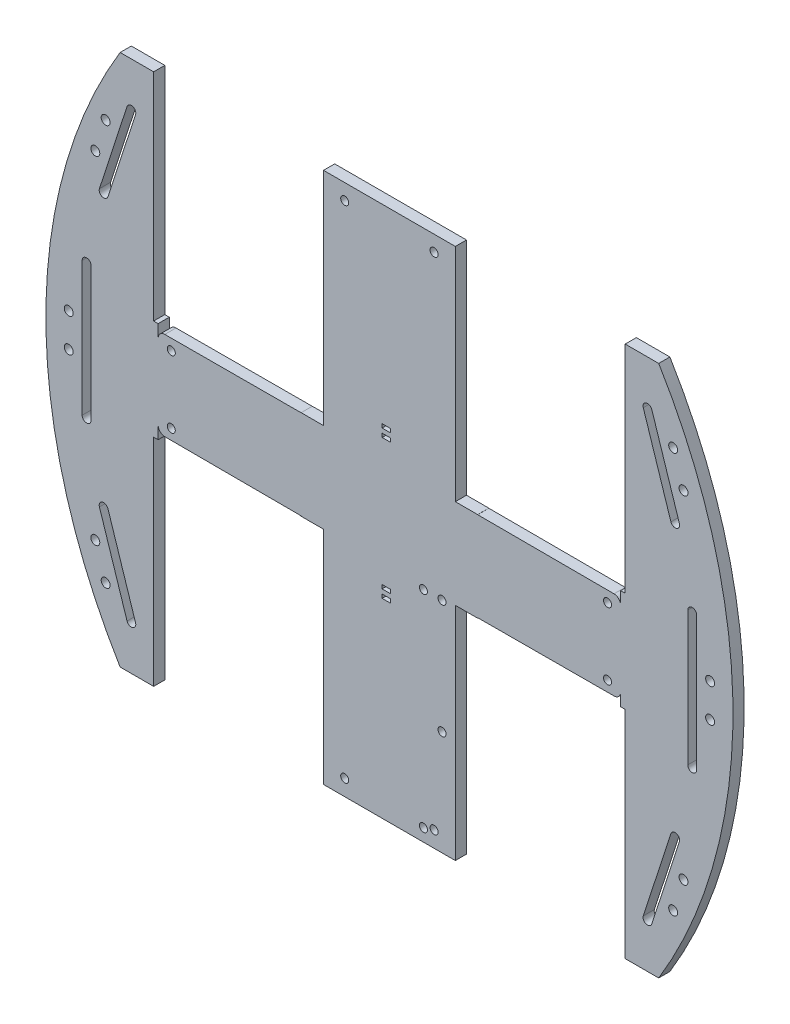
from build123d import *

# Parameters (mm, degrees)
SKETCH1_R                = 1.900570712
SKETCH1_R_2              = 1.8
SKETCH1_W                = 3.7
SKETCH1_H                = 1.7
BOSS_EXTRUDE1_DEPTH      = 5
EXTRUDE_1_DEPTH          = 5
SKETCH_3_R               = 2
CUT_EXTRUDE_1_DEPTH      = 10
SKETCH_4_W               = 36
SKETCH_4_H               = 122.010082943
CUT_EXTRUDE_2_DEPTH      = 10
MIRROR_3_COPY_1_SKETCH_W = 36
MIRROR_3_COPY_1_SKETCH_H = 122.010082943
MIRROR_3_COPY_1_DEPTH    = 10
SKETCH_5_R               = 1.8
CUT_EXTRUDE_3_DEPTH      = 10
SKETCH_6_W               = 40
SKETCH_6_H               = 87.108674809
SKETCH_6_H_2             = 94.794026774
CUT_EXTRUDE_4_DEPTH      = 10
MOVE_BODY_1_OUTLINE_R    = 2
MOVE_BODY_1_OUTLINE_R_2  = 1.8
MOVE_BODY_1_DEPTH        = 5
MOVE_BODY_1_2_OUTLINE_R  = 2
MOVE_BODY_1_2_DEPTH      = 5
MOVE_BODY_2_OUTLINE_R    = 2
MOVE_BODY_2_OUTLINE_R_2  = 1.8
MOVE_BODY_2_DEPTH        = 5
MOVE_BODY_2_2_OUTLINE_R  = 2
MOVE_BODY_2_2_DEPTH      = 5


# Read off the part's stored shape, not the designer's step: 实体-移动/复制1, 实体-移动/复制2
with BuildPart() as part:
    # Sketch1 → Boss-Extrude1 (new body)
    with BuildSketch(Plane.XY):
        with BuildLine():
            Line((574.297966195, 345.770331231), (574.297966195, 252.84955811))
            ThreePointArc((574.297966195, 252.84955811), (573.421844679, 250.730798995), (571.305206071, 249.849566845))
            Line((571.305206071, 249.849566845), (496.29072632, 249.668534486))
            ThreePointArc((496.29072632, 249.668534486), (494.174087712, 248.787302337), (493.297966196, 246.668543222))
            Line((493.297966196, 246.668543222), (493.297966196, 213.041101049))
            ThreePointArc((493.297966196, 213.041101049), (494.173481414, 210.922949871), (496.289009139, 210.04111442))
            Line((496.289009139, 210.04111442), (571.306923252, 209.817133512))
            ThreePointArc((571.306923252, 209.817133512), (573.422450977, 208.935298062), (574.297966195, 206.817146883))
            Line((574.297966195, 206.817146883), (574.297966195, 113.770331231))
            ThreePointArc((574.297966195, 113.770331231), (575.176645852, 111.649010887), (577.297966195, 110.770331231))
            Line((577.297966195, 110.770331231), (696.297966195, 110.770331231))
            ThreePointArc((696.297966195, 110.770331231), (698.419286539, 111.649010887), (699.297966195, 113.770331231))
            Line((699.297966195, 113.770331231), (699.297966195, 206.844947939))
            ThreePointArc((699.297966195, 206.844947939), (700.173481414, 208.963099117), (702.289009139, 209.844934567))
            Line((702.289009139, 209.844934567), (777.306923252, 210.068915476))
            ThreePointArc((777.306923252, 210.068915476), (779.422450977, 210.950750926), (780.297966195, 213.068902104))
            Line((780.297966195, 213.068902104), (780.297966195, 246.658109642))
            ThreePointArc((780.297966195, 246.658109642), (779.421844679, 248.776868757), (777.305206071, 249.658100906))
            Line((777.305206071, 249.658100906), (702.29072632, 249.839133265))
            ThreePointArc((702.29072632, 249.839133265), (700.174087712, 250.720365414), (699.297966195, 252.839124529))
            Line((699.297966195, 252.839124529), (699.297966195, 345.770331231))
            ThreePointArc((699.297966195, 345.770331231), (698.419286539, 347.891651574), (696.297966195, 348.770331231))
            Line((696.297966195, 348.770331231), (577.297966195, 348.770331231))
            ThreePointArc((577.297966195, 348.770331231), (575.176645852, 347.891651574), (574.297966195, 345.770331231))
        make_face()
        with Locations((693.904414249, 343.166011633)):
            Circle(SKETCH1_R, mode=Mode.SUBTRACT)
        with Locations((579.691518142, 343.166011633)):
            Circle(SKETCH1_R, mode=Mode.SUBTRACT)
        with Locations((579.691518142, 116.374650828)):
            Circle(SKETCH1_R, mode=Mode.SUBTRACT)
        with Locations((693.904414249, 116.374650828)):
            Circle(SKETCH1_R, mode=Mode.SUBTRACT)
        with Locations((499.187949141, 244.770331231)):
            Circle(SKETCH1_R_2, mode=Mode.SUBTRACT)
        with Locations((499.187949141, 214.770331231)):
            Circle(SKETCH1_R_2, mode=Mode.SUBTRACT)
        with Locations((774.40798325, 214.770331231)):
            Circle(SKETCH1_R_2, mode=Mode.SUBTRACT)
        with Locations((774.40798325, 244.770331231)):
            Circle(SKETCH1_R_2, mode=Mode.SUBTRACT)
        with Locations((652.022655019, 116.374650828)):
            Circle(SKETCH1_R_2, mode=Mode.SUBTRACT)
        with Locations((579.691518142, 208.681991365)):
            Circle(SKETCH1_R_2, mode=Mode.SUBTRACT)
        with Locations((652.022655019, 208.681991365)):
            Circle(SKETCH1_R_2, mode=Mode.SUBTRACT)
        with Locations((660.343138524, 208.681991365)):
            Circle(SKETCH1_R_2, mode=Mode.SUBTRACT)
        with Locations((660.343138524, 157.709637408)):
            Circle(SKETCH1_R_2, mode=Mode.SUBTRACT)
        with Locations((588.800179723, 343.166011633)):
            Circle(SKETCH1_R_2, mode=Mode.SUBTRACT)
        with Locations((680.783131354, 343.166011633)):
            Circle(SKETCH1_R_2, mode=Mode.SUBTRACT)
        with Locations((588.800179723, 294.134128637)):
            Circle(SKETCH1_R_2, mode=Mode.SUBTRACT)
        with Locations((680.783131354, 294.134128637)):
            Circle(SKETCH1_R_2, mode=Mode.SUBTRACT)
        with Locations((679.001081581, 257.310382439)):
            Circle(SKETCH1_R_2, mode=Mode.SUBTRACT)
        with Locations((679.001081581, 202.230280022)):
            Circle(SKETCH1_R_2, mode=Mode.SUBTRACT)
        with Locations((691.351720992, 262.972382574)):
            Rectangle(SKETCH1_W, SKETCH1_H, mode=Mode.SUBTRACT)
        with Locations((635.379169568, 262.865362101)):
            Rectangle(SKETCH1_W, SKETCH1_H, mode=Mode.SUBTRACT)
        with Locations((635.379169568, 259.195140051)):
            Rectangle(SKETCH1_W, SKETCH1_H, mode=Mode.SUBTRACT)
        with Locations((691.351720992, 259.302160524)):
            Rectangle(SKETCH1_W, SKETCH1_H, mode=Mode.SUBTRACT)
        with Locations((581.09547191, 263.432517865)):
            Rectangle(SKETCH1_W, SKETCH1_H, mode=Mode.SUBTRACT)
        with Locations((581.09547191, 259.762295814)):
            Rectangle(SKETCH1_W, SKETCH1_H, mode=Mode.SUBTRACT)
        with Locations((705.553039017, 231.567054145)):
            Rectangle(SKETCH1_W, SKETCH1_H, mode=Mode.SUBTRACT)
        Polygon((579.247230132, 200.802549524), (579.247333006, 199.102549528), (582.947332999, 199.102773429), (582.947230125, 200.802773426), align=None, mode=Mode.SUBTRACT)
        Polygon((579.247555105, 195.432327484), (579.247452231, 197.132327481), (582.947452224, 197.132551382), (582.947555098, 195.432551385), align=None, mode=Mode.SUBTRACT)
        Polygon((689.503776141, 195.899134804), (689.503673267, 197.599134801), (693.20367326, 197.599358702), (693.203776134, 195.899358705), align=None, mode=Mode.SUBTRACT)
        Polygon((689.503451168, 201.269356845), (689.503554042, 199.569356848), (693.203554035, 199.569580749), (693.203451161, 201.269580746), align=None, mode=Mode.SUBTRACT)
        Polygon((633.53089337, 201.372990203), (633.530996244, 199.672990206), (637.230996237, 199.673214107), (637.230893363, 201.373214104), align=None, mode=Mode.SUBTRACT)
        Polygon((633.531115469, 197.702768159), (637.231115462, 197.70299206), (637.231218336, 196.002992063), (633.531218343, 196.002768162), align=None, mode=Mode.SUBTRACT)
        with Locations((705.553039017, 227.896832094)):
            Rectangle(SKETCH1_W, SKETCH1_H, mode=Mode.SUBTRACT)
        with Locations((567.510094044, 231.974260472)):
            Rectangle(SKETCH1_W, SKETCH1_H, mode=Mode.SUBTRACT)
        with Locations((567.510094044, 228.304038421)):
            Rectangle(SKETCH1_W, SKETCH1_H, mode=Mode.SUBTRACT)
    extrude(amount=BOSS_EXTRUDE1_DEPTH)

    # 草图1 → 凸台-拉伸1 (add)
    with BuildSketch(Plane(origin=(0, 0, 0), x_dir=(-1, 0, 0), z_dir=(0, 0, -1))):
        with BuildLine():
            Line((-493.297966196, 252.354822136), (-493.297966196, 207.354822136))
            Line((-493.297966196, 207.354822136), (-491.297966196, 207.354822136))
            Line((-491.297966196, 207.354822136), (-491.297966196, 110.770331231))
            Line((-491.297966196, 110.770331231), (-476.297966196, 110.770331231))
            ThreePointArc((-476.297966196, 110.770331231), (-443.06911252, 229.854822136), (-476.297966196, 348.939313041))
            Line((-476.297966196, 348.939313041), (-491.297966196, 348.939313041))
            Line((-491.297966196, 348.939313041), (-491.297966196, 252.354822136))
            Line((-491.297966196, 252.354822136), (-493.297966196, 252.354822136))
        make_face()
    extrude_1 = extrude(amount=-EXTRUDE_1_DEPTH)

    # 草图3 → 切除-拉伸1 (cut)
    with BuildSketch(Plane(origin=(0, 0, 0), x_dir=(-1, 0, 0), z_dir=(0, 0, -1))):
        with Locations((-469.826801635, 319.523242542)):
            Circle(SKETCH_3_R)
        with Locations((-465.19154672, 305.257394797)):
            Circle(SKETCH_3_R)
        with Locations((-453.297966195, 237.354822136)):
            Circle(SKETCH_3_R)
        with Locations((-453.297966195, 222.354822136)):
            Circle(SKETCH_3_R)
        with Locations(Location((-465.19154672, 154.452249474, 0), (0, 0, 180))):
            Circle(SKETCH_3_R)
        with Locations(Location((-469.826801635, 140.186401729, 0), (0, 0, 180))):
            Circle(SKETCH_3_R)
        with BuildLine():
            Line((-459.297966196, 259.854822136), (-459.297966196, 199.854822136))
            ThreePointArc((-459.297966196, 199.854822136), (-461.297966196, 197.854822136), (-463.297966195, 199.854822136))
            Line((-463.297966195, 199.854822136), (-463.297966195, 259.854822136))
            ThreePointArc((-463.297966195, 259.854822136), (-461.297966196, 261.854822136), (-459.297966196, 259.854822136))
        make_face()
        with BuildLine():
            Line((-479.395853163, 329.557347029), (-467.035173388, 291.515086377))
            ThreePointArc((-467.035173388, 291.515086377), (-468.319252432, 288.994939356), (-470.839399453, 290.2790184))
            Line((-470.839399453, 290.2790184), (-483.200079228, 328.321279052))
            ThreePointArc((-483.200079228, 328.321279052), (-481.916000184, 330.841426073), (-479.395853163, 329.557347029))
        make_face()
        with BuildLine():
            Line((-479.395853163, 130.152297242), (-467.035173388, 168.194557894))
            ThreePointArc((-467.035173388, 168.194557894), (-468.319252432, 170.714704915), (-470.839399453, 169.430625871))
            Line((-470.839399453, 169.430625871), (-483.200079228, 131.388365219))
            ThreePointArc((-483.200079228, 131.388365219), (-481.916000184, 128.868218198), (-479.395853163, 130.152297242))
        make_face()
    cut_extrude_1 = extrude(amount=-CUT_EXTRUDE_1_DEPTH, mode=Mode.SUBTRACT)

    # 镜向1: 凸台-拉伸1, 切除-拉伸1 across plane
    add(extrude_1.mirror(Plane(origin=(636.797966195, 0, 0), x_dir=(0, 0, 1), z_dir=(1, 0, 0))))
    add(cut_extrude_1.mirror(Plane(origin=(636.797966195, 0, 0), x_dir=(0, 0, 1), z_dir=(1, 0, 0))), mode=Mode.SUBTRACT)

    # 草图4 → 切除-拉伸2 (cut)
    with BuildSketch(Plane(origin=(0, 0, 0), x_dir=(-1, 0, 0), z_dir=(0, 0, -1))):
        with Locations((-589.305206071, 310.854608317)):
            Rectangle(SKETCH_4_W, SKETCH_4_H)
    cut_extrude_2 = extrude(amount=-CUT_EXTRUDE_2_DEPTH, mode=Mode.SUBTRACT)

    # 镜向2: 切除-拉伸2 across plane
    add(cut_extrude_2.mirror(Plane.ZX.offset(229.770331231)), mode=Mode.SUBTRACT)

    # 镜向3: 切除-拉伸2 across plane
    add(cut_extrude_2.mirror(Plane(origin=(636.797966195, 0, 0), x_dir=(0, 0, 1), z_dir=(1, 0, 0))), mode=Mode.SUBTRACT)

    # 镜向3 copy 1 sketch → 镜向3 copy 1 (cut)
    with BuildSketch(Plane(origin=(1273.595932391, 459.540662461, 0), x_dir=(1, 0, 0), z_dir=(0, 0, -1))):
        with Locations((-589.305206071, 310.854608317)):
            Rectangle(MIRROR_3_COPY_1_SKETCH_W, MIRROR_3_COPY_1_SKETCH_H)
    extrude(amount=-MIRROR_3_COPY_1_DEPTH, mode=Mode.SUBTRACT)

    # 草图5 → 切除-拉伸3 (cut)
    with BuildSketch(Plane(origin=(0, 0, 0), x_dir=(-1, 0, 0), z_dir=(0, 0, -1))):
        with Locations((-616.797966196, 341.770331231)):
            Circle(SKETCH_5_R)
        with Locations((-656.797966196, 341.770331231)):
            Circle(SKETCH_5_R)
        with Locations((-656.797966196, 117.939313041)):
            Circle(SKETCH_5_R)
        with Locations((-616.797966196, 117.939313041)):
            Circle(SKETCH_5_R)
    extrude(amount=-CUT_EXTRUDE_3_DEPTH, mode=Mode.SUBTRACT)

    # 草图6 → 切除-拉伸4 (cut)
    with BuildSketch(Plane(origin=(0, 0, 0), x_dir=(-1, 0, 0), z_dir=(0, 0, -1))):
        with Locations((-577.305206071, 229.860966088)):
            Rectangle(SKETCH_6_W, SKETCH_6_H)
        with Locations((-696.29072632, 226.018290106)):
            Rectangle(SKETCH_6_W, SKETCH_6_H_2)
    extrude(amount=-CUT_EXTRUDE_4_DEPTH, mode=Mode.SUBTRACT)


with BuildPart() as cut_extrude_4_piece_1:
    # of the separate pieces the step leaves, piece 1, a body of its own (cut_extrude_4_pieces)
    add(part.part.solids().sort_by_distance((676.29072632, 209.691095616, 0))[0])


with BuildPart() as cut_extrude_4_piece_2:
    # of the separate pieces the step leaves, piece 2, a body of its own (cut_extrude_4_pieces)
    add(part.part.solids().sort_by_distance((557.305206071, 209.858938424, 0))[0])

    # Move Body 1 outline → Move Body 1 (cut)
    # profile 1 of 8: a face of its own
    with BuildSketch(Plane.XY):
        with BuildLine():
            Line((533.297966195, 213.041101049), (533.297966195, 209.930616815))
            Line((533.297966195, 209.930616815), (557.305206071, 209.858938424))
            Line((557.305206071, 209.858938424), (557.305206071, 209.978366383))
            Line((557.305206071, 209.978366383), (536.289009139, 210.04111442))
            ThreePointArc((536.289009139, 210.04111442), (534.173481415, 210.92294987), (533.297966195, 213.041101049))
        make_face()
    # profile 2 of 8: a face of its own
    with BuildSketch(Plane.XY):
        with BuildLine():
            Line((499.297966196, 210.03213058), (503.297966196, 210.020187784))
            Line((503.297966196, 210.020187784), (503.297966196, 249.68544505))
            Line((503.297966196, 249.68544505), (499.297966196, 249.675791855))
            Line((499.297966196, 249.675791855), (499.297966196, 246.566965932))
            ThreePointArc((499.297966196, 246.566965932), (500.987949141, 244.770331231), (499.297966196, 242.97369653))
            Line((499.297966196, 242.97369653), (499.297966196, 216.566965932))
            ThreePointArc((499.297966196, 216.566965932), (500.987949141, 214.770331231), (499.297966196, 212.97369653))
            Line((499.297966196, 212.97369653), (499.297966196, 210.03213058))
        make_face()
    # profile 3 of 8: a face of its own
    with BuildSketch(Plane.XY):
        with BuildLine():
            Line((491.297966196, 110.770331231), (491.297966196, 168.883036382))
            ThreePointArc((491.297966196, 168.883036382), (483.06911252, 229.854822136), (491.297966196, 290.82660789))
            Line((491.297966196, 290.82660789), (491.297966196, 348.939313041))
            Line((491.297966196, 348.939313041), (476.297966196, 348.939313041))
            ThreePointArc((476.297966196, 348.939313041), (443.06911252, 229.854822136), (476.297966195, 110.770331231))
            Line((476.297966195, 110.770331231), (491.297966196, 110.770331231))
        make_face()
        with Locations((469.826801635, 140.186401729)):
            Circle(MOVE_BODY_1_OUTLINE_R, mode=Mode.SUBTRACT)
        with Locations((465.19154672, 154.452249474)):
            Circle(MOVE_BODY_1_OUTLINE_R, mode=Mode.SUBTRACT)
        with BuildLine():
            Line((470.839399453, 169.430625871), (483.200079228, 131.388365219))
            ThreePointArc((483.200079228, 131.388365219), (481.916000184, 128.868218198), (479.395853163, 130.152297242))
            Line((479.395853163, 130.152297242), (467.035173388, 168.194557894))
            ThreePointArc((467.035173388, 168.194557894), (468.319252432, 170.714704915), (470.839399453, 169.430625871))
        make_face(mode=Mode.SUBTRACT)
        with Locations((453.297966196, 222.354822136)):
            Circle(MOVE_BODY_1_OUTLINE_R, mode=Mode.SUBTRACT)
        with BuildLine():
            Line((459.297966196, 199.854822136), (459.297966196, 259.854822136))
            ThreePointArc((459.297966196, 259.854822136), (461.297966196, 261.854822136), (463.297966195, 259.854822136))
            Line((463.297966195, 259.854822136), (463.297966195, 199.854822136))
            ThreePointArc((463.297966195, 199.854822136), (461.297966196, 197.854822136), (459.297966196, 199.854822136))
        make_face(mode=Mode.SUBTRACT)
        with Locations((453.297966196, 237.354822136)):
            Circle(MOVE_BODY_1_OUTLINE_R, mode=Mode.SUBTRACT)
        with Locations((465.19154672, 305.257394797)):
            Circle(MOVE_BODY_1_OUTLINE_R, mode=Mode.SUBTRACT)
        with BuildLine():
            Line((467.035173388, 291.515086377), (479.395853163, 329.557347029))
            ThreePointArc((479.395853163, 329.557347029), (481.916000184, 330.841426073), (483.200079228, 328.321279052))
            Line((483.200079228, 328.321279052), (470.839399453, 290.2790184))
            ThreePointArc((470.839399453, 290.2790184), (468.319252432, 288.994939356), (467.035173388, 291.515086377))
        make_face(mode=Mode.SUBTRACT)
        with Locations((469.826801635, 319.523242542)):
            Circle(MOVE_BODY_1_OUTLINE_R, mode=Mode.SUBTRACT)
    # profile 4 of 8: a face of its own
    with BuildSketch(Plane.XY):
        with BuildLine():
            Line((536.29072632, 249.668534486), (557.305206071, 249.719248706))
            Line((557.305206071, 249.719248706), (557.305206071, 249.815780661))
            Line((557.305206071, 249.815780661), (533.297966195, 249.757844016))
            Line((533.297966195, 249.757844016), (533.297966195, 246.668543222))
            ThreePointArc((533.297966195, 246.668543222), (534.174087712, 248.787302337), (536.29072632, 249.668534486))
        make_face()
    # profile 5 of 8: a face of its own
    with BuildSketch(Plane.XY):
        with Locations((539.187949141, 244.770331231)):
            Circle(MOVE_BODY_1_OUTLINE_R_2)
    # profile 6 of 8: a face of its own
    with BuildSketch(Plane.XY):
        with Locations((539.187949141, 214.770331231)):
            Circle(MOVE_BODY_1_OUTLINE_R_2)
    # profile 7 of 8: a face of its own
    with BuildSketch(Plane.XY):
        with Locations((493.297966196, 237.354822136)):
            Circle(MOVE_BODY_1_OUTLINE_R)
    # profile 8 of 8: a face of its own
    with BuildSketch(Plane.XY):
        with Locations((493.297966196, 222.354822136)):
            Circle(MOVE_BODY_1_OUTLINE_R)
    extrude(amount=MOVE_BODY_1_DEPTH, mode=Mode.SUBTRACT)

    # Move Body 1 2 outline → Move Body 1 2 (add)
    # profile 1 of 5: a face of its own
    with BuildSketch(Plane.XY):
        with BuildLine():
            Line((531.297966195, 110.770331231), (531.297966195, 207.354822136))
            Line((531.297966195, 207.354822136), (533.297966195, 207.354822136))
            Line((533.297966195, 207.354822136), (533.297966195, 209.930616815))
            Line((533.297966195, 209.930616815), (503.297966196, 210.020187784))
            Line((503.297966196, 210.020187784), (503.297966195, 199.854822136))
            ThreePointArc((503.297966195, 199.854822136), (501.297966196, 197.854822136), (499.297966196, 199.854822136))
            Line((499.297966196, 199.854822136), (499.297966196, 210.03213058))
            Line((499.297966196, 210.03213058), (496.289009139, 210.04111442))
            ThreePointArc((496.289009139, 210.04111442), (494.173481415, 210.92294987), (493.297966196, 213.041101049))
            Line((493.297966196, 213.041101049), (493.297966196, 207.354822136))
            Line((493.297966196, 207.354822136), (491.297966196, 207.354822136))
            Line((491.297966196, 207.354822136), (491.297966196, 168.883036382))
            ThreePointArc((491.297966196, 168.883036382), (501.790423796, 138.963042028), (516.297966196, 110.770331231))
            Line((516.297966196, 110.770331231), (531.297966195, 110.770331231))
        make_face()
        with Locations((509.826801635, 140.186401729)):
            Circle(MOVE_BODY_1_2_OUTLINE_R, mode=Mode.SUBTRACT)
        with Locations((505.19154672, 154.452249474)):
            Circle(MOVE_BODY_1_2_OUTLINE_R, mode=Mode.SUBTRACT)
        with BuildLine():
            Line((510.839399453, 169.430625871), (523.200079228, 131.388365219))
            ThreePointArc((523.200079228, 131.388365219), (521.916000184, 128.868218198), (519.395853163, 130.152297242))
            Line((519.395853163, 130.152297242), (507.035173388, 168.194557894))
            ThreePointArc((507.035173388, 168.194557894), (508.319252432, 170.714704915), (510.839399453, 169.430625871))
        make_face(mode=Mode.SUBTRACT)
    # profile 2 of 5: a face of its own
    with BuildSketch(Plane.XY):
        Polygon((557.305206071, 249.719248706), (557.305206071, 209.978366383), (597.305206071, 209.858938424), (597.305206071, 249.815780661), align=None)
    # profile 3 of 5: a face of its own
    with BuildSketch(Plane.XY):
        with BuildLine():
            Line((503.297966195, 259.854822136), (503.297966196, 249.68544505))
            Line((503.297966196, 249.68544505), (533.297966195, 249.757844016))
            Line((533.297966195, 249.757844016), (533.297966195, 252.354822136))
            Line((533.297966195, 252.354822136), (531.297966195, 252.354822136))
            Line((531.297966195, 252.354822136), (531.297966195, 348.939313041))
            Line((531.297966195, 348.939313041), (516.297966196, 348.939313041))
            ThreePointArc((516.297966196, 348.939313041), (501.790423796, 320.746602244), (491.297966196, 290.82660789))
            Line((491.297966196, 290.82660789), (491.297966196, 252.354822136))
            Line((491.297966196, 252.354822136), (493.297966196, 252.354822136))
            Line((493.297966196, 252.354822136), (493.297966196, 246.668543222))
            ThreePointArc((493.297966196, 246.668543222), (494.174087712, 248.787302337), (496.29072632, 249.668534486))
            Line((496.29072632, 249.668534486), (499.297966196, 249.675791855))
            Line((499.297966196, 249.675791855), (499.297966196, 259.854822136))
            ThreePointArc((499.297966196, 259.854822136), (501.297966196, 261.854822136), (503.297966195, 259.854822136))
        make_face()
        with Locations((505.19154672, 305.257394797)):
            Circle(MOVE_BODY_1_2_OUTLINE_R, mode=Mode.SUBTRACT)
        with BuildLine():
            Line((507.035173388, 291.515086377), (519.395853163, 329.557347029))
            ThreePointArc((519.395853163, 329.557347029), (521.916000184, 330.841426073), (523.200079228, 328.321279052))
            Line((523.200079228, 328.321279052), (510.839399453, 290.2790184))
            ThreePointArc((510.839399453, 290.2790184), (508.319252432, 288.994939356), (507.035173388, 291.515086377))
        make_face(mode=Mode.SUBTRACT)
        with Locations((509.826801635, 319.523242542)):
            Circle(MOVE_BODY_1_2_OUTLINE_R, mode=Mode.SUBTRACT)
    # profile 4 of 5: a face of its own
    with BuildSketch(Plane.XY):
        with BuildLine():
            ThreePointArc((499.297966196, 216.566965932), (497.387949141, 214.770331231), (499.297966196, 212.97369653))
            Line((499.297966196, 212.97369653), (499.297966196, 216.566965932))
        make_face()
    # profile 5 of 5: a face of its own
    with BuildSketch(Plane.XY):
        with BuildLine():
            Line((499.297966196, 242.97369653), (499.297966196, 246.566965932))
            ThreePointArc((499.297966196, 246.566965932), (497.387949141, 244.770331231), (499.297966196, 242.97369653))
        make_face()
    extrude(amount=MOVE_BODY_1_2_DEPTH)


with BuildPart() as cut_extrude_4_piece_3:
    # of the separate pieces the step leaves, piece 3, a body of its own (cut_extrude_4_pieces)
    add(part.part.solids().sort_by_distance((780.297966195, 252.354822136, 0))[0])

    # Move Body 2 outline → Move Body 2 (cut)
    # profile 1 of 8: a face of its own
    with BuildSketch(Plane.XY):
        with BuildLine():
            Line((716.29072632, 209.88673948), (740.297966195, 209.958417871))
            Line((740.297966195, 209.958417871), (740.297966195, 213.068902104))
            ThreePointArc((740.297966195, 213.068902104), (739.422450976, 210.950750925), (737.306923252, 210.068915476))
            Line((737.306923252, 210.068915476), (716.29072632, 210.006167439))
            Line((716.29072632, 210.006167439), (716.29072632, 209.88673948))
        make_face()
    # profile 2 of 8: a face of its own
    with BuildSketch(Plane.XY):
        with BuildLine():
            Line((770.297966195, 249.67501147), (770.297966195, 210.04798884))
            Line((770.297966195, 210.04798884), (774.297966195, 210.059931636))
            Line((774.297966195, 210.059931636), (774.297966195, 212.97369653))
            ThreePointArc((774.297966195, 212.97369653), (772.60798325, 214.770331231), (774.297966195, 216.566965932))
            Line((774.297966195, 216.566965932), (774.297966195, 242.97369653))
            ThreePointArc((774.297966195, 242.97369653), (772.60798325, 244.770331231), (774.297966195, 246.566965932))
            Line((774.297966195, 246.566965932), (774.297966195, 249.665358275))
            Line((774.297966195, 249.665358275), (770.297966195, 249.67501147))
        make_face()
    # profile 3 of 8: a face of its own
    with BuildSketch(Plane.XY):
        with BuildLine():
            Line((716.29072632, 249.805347081), (716.29072632, 249.708815126))
            Line((716.29072632, 249.708815126), (737.305206071, 249.658100906))
            ThreePointArc((737.305206071, 249.658100906), (739.421844679, 248.776868757), (740.297966195, 246.658109642))
            Line((740.297966195, 246.658109642), (740.297966195, 249.747410436))
            Line((740.297966195, 249.747410436), (716.29072632, 249.805347081))
        make_face()
    # profile 4 of 8: a face of its own
    with BuildSketch(Plane.XY):
        with BuildLine():
            ThreePointArc((782.297966195, 290.82660789), (790.526819871, 229.854822136), (782.297966195, 168.883036382))
            Line((782.297966195, 168.883036382), (782.297966195, 110.770331231))
            Line((782.297966195, 110.770331231), (797.297966196, 110.770331231))
            ThreePointArc((797.297966196, 110.770331231), (830.526819871, 229.854822136), (797.297966196, 348.939313041))
            Line((797.297966196, 348.939313041), (782.297966195, 348.939313041))
            Line((782.297966195, 348.939313041), (782.297966195, 290.82660789))
        make_face()
        with Locations((803.769130756, 140.186401729)):
            Circle(MOVE_BODY_2_OUTLINE_R, mode=Mode.SUBTRACT)
        with BuildLine():
            ThreePointArc((794.200079228, 130.152297242), (791.679932207, 128.868218198), (790.395853163, 131.388365219))
            Line((790.395853163, 131.388365219), (802.756532938, 169.430625871))
            ThreePointArc((802.756532938, 169.430625871), (805.276679959, 170.714704915), (806.560759003, 168.194557894))
            Line((806.560759003, 168.194557894), (794.200079228, 130.152297242))
        make_face(mode=Mode.SUBTRACT)
        with Locations((808.404385671, 154.452249474)):
            Circle(MOVE_BODY_2_OUTLINE_R, mode=Mode.SUBTRACT)
        with Locations((820.297966195, 222.354822136)):
            Circle(MOVE_BODY_2_OUTLINE_R, mode=Mode.SUBTRACT)
        with BuildLine():
            ThreePointArc((810.297966195, 259.854822136), (812.297966195, 261.854822136), (814.297966195, 259.854822136))
            Line((814.297966195, 259.854822136), (814.297966195, 199.854822136))
            ThreePointArc((814.297966195, 199.854822136), (812.297966195, 197.854822136), (810.297966195, 199.854822136))
            Line((810.297966195, 199.854822136), (810.297966195, 259.854822136))
        make_face(mode=Mode.SUBTRACT)
        with Locations((820.297966195, 237.354822136)):
            Circle(MOVE_BODY_2_OUTLINE_R, mode=Mode.SUBTRACT)
        with BuildLine():
            ThreePointArc((790.395853163, 328.321279052), (791.679932207, 330.841426073), (794.200079228, 329.557347029))
            Line((794.200079228, 329.557347029), (806.560759003, 291.515086377))
            ThreePointArc((806.560759003, 291.515086377), (805.276679959, 288.994939356), (802.756532938, 290.2790184))
            Line((802.756532938, 290.2790184), (790.395853163, 328.321279052))
        make_face(mode=Mode.SUBTRACT)
        with Locations((808.404385671, 305.257394797)):
            Circle(MOVE_BODY_2_OUTLINE_R, mode=Mode.SUBTRACT)
        with Locations((803.769130756, 319.523242542)):
            Circle(MOVE_BODY_2_OUTLINE_R, mode=Mode.SUBTRACT)
    # profile 5 of 8: a face of its own
    with BuildSketch(Plane.XY):
        with Locations((780.297966195, 222.354822136)):
            Circle(MOVE_BODY_2_OUTLINE_R)
    # profile 6 of 8: a face of its own
    with BuildSketch(Plane.XY):
        with Locations((780.297966195, 237.354822136)):
            Circle(MOVE_BODY_2_OUTLINE_R)
    # profile 7 of 8: a face of its own
    with BuildSketch(Plane.XY):
        with Locations((734.40798325, 214.770331231)):
            Circle(MOVE_BODY_2_OUTLINE_R_2)
    # profile 8 of 8: a face of its own
    with BuildSketch(Plane.XY):
        with Locations((734.40798325, 244.770331231)):
            Circle(MOVE_BODY_2_OUTLINE_R_2)
    extrude(amount=MOVE_BODY_2_DEPTH, mode=Mode.SUBTRACT)

    # Move Body 2 2 outline → Move Body 2 2 (add)
    # profile 1 of 5: a face of its own
    with BuildSketch(Plane.XY):
        with BuildLine():
            Line((740.297966195, 209.958417871), (740.297966195, 207.354822136))
            Line((740.297966195, 207.354822136), (742.297966195, 207.354822136))
            Line((742.297966195, 207.354822136), (742.297966195, 110.770331231))
            Line((742.297966195, 110.770331231), (757.297966195, 110.770331231))
            ThreePointArc((757.297966195, 110.770331231), (771.805508595, 138.963042028), (782.297966195, 168.883036382))
            Line((782.297966195, 168.883036382), (782.297966195, 207.354822136))
            Line((782.297966195, 207.354822136), (780.297966195, 207.354822136))
            Line((780.297966195, 207.354822136), (780.297966195, 213.068902104))
            ThreePointArc((780.297966195, 213.068902104), (779.422450976, 210.950750925), (777.306923252, 210.068915476))
            Line((777.306923252, 210.068915476), (774.297966195, 210.059931636))
            Line((774.297966195, 210.059931636), (774.297966195, 199.854822136))
            ThreePointArc((774.297966195, 199.854822136), (772.297966195, 197.854822136), (770.297966195, 199.854822136))
            Line((770.297966195, 199.854822136), (770.297966195, 210.04798884))
            Line((770.297966195, 210.04798884), (740.297966195, 209.958417871))
        make_face()
        with Locations((763.769130756, 140.186401729)):
            Circle(MOVE_BODY_2_2_OUTLINE_R, mode=Mode.SUBTRACT)
        with BuildLine():
            ThreePointArc((754.200079228, 130.152297242), (751.679932207, 128.868218198), (750.395853163, 131.388365219))
            Line((750.395853163, 131.388365219), (762.756532938, 169.430625871))
            ThreePointArc((762.756532938, 169.430625871), (765.276679959, 170.714704915), (766.560759003, 168.194557894))
            Line((766.560759003, 168.194557894), (754.200079228, 130.152297242))
        make_face(mode=Mode.SUBTRACT)
        with Locations((768.404385671, 154.452249474)):
            Circle(MOVE_BODY_2_2_OUTLINE_R, mode=Mode.SUBTRACT)
    # profile 2 of 5: a face of its own
    with BuildSketch(Plane.XY):
        Polygon((676.29072632, 209.88673948), (716.29072632, 210.006167439), (716.29072632, 249.708815126), (676.29072632, 249.805347081), align=None)
    # profile 3 of 5: a face of its own
    with BuildSketch(Plane.XY):
        with BuildLine():
            Line((740.297966195, 249.747410436), (770.297966195, 249.67501147))
            Line((770.297966195, 249.67501147), (770.297966195, 259.854822136))
            ThreePointArc((770.297966195, 259.854822136), (772.297966195, 261.854822136), (774.297966195, 259.854822136))
            Line((774.297966195, 259.854822136), (774.297966195, 249.665358275))
            Line((774.297966195, 249.665358275), (777.305206071, 249.658100906))
            ThreePointArc((777.305206071, 249.658100906), (779.421844679, 248.776868757), (780.297966195, 246.658109642))
            Line((780.297966195, 246.658109642), (780.297966195, 252.354822136))
            Line((780.297966195, 252.354822136), (782.297966195, 252.354822136))
            Line((782.297966195, 252.354822136), (782.297966195, 290.82660789))
            ThreePointArc((782.297966195, 290.82660789), (771.805508595, 320.746602244), (757.297966195, 348.939313041))
            Line((757.297966195, 348.939313041), (742.297966195, 348.939313041))
            Line((742.297966195, 348.939313041), (742.297966195, 252.354822136))
            Line((742.297966195, 252.354822136), (740.297966195, 252.354822136))
            Line((740.297966195, 252.354822136), (740.297966195, 249.747410436))
        make_face()
        with BuildLine():
            ThreePointArc((750.395853163, 328.321279052), (751.679932207, 330.841426073), (754.200079228, 329.557347029))
            Line((754.200079228, 329.557347029), (766.560759003, 291.515086377))
            ThreePointArc((766.560759003, 291.515086377), (765.276679959, 288.994939356), (762.756532938, 290.2790184))
            Line((762.756532938, 290.2790184), (750.395853163, 328.321279052))
        make_face(mode=Mode.SUBTRACT)
        with Locations((768.404385671, 305.257394797)):
            Circle(MOVE_BODY_2_2_OUTLINE_R, mode=Mode.SUBTRACT)
        with Locations((763.769130756, 319.523242542)):
            Circle(MOVE_BODY_2_2_OUTLINE_R, mode=Mode.SUBTRACT)
    # profile 4 of 5: a face of its own
    with BuildSketch(Plane.XY):
        with BuildLine():
            Line((774.297966195, 216.566965932), (774.297966195, 212.97369653))
            ThreePointArc((774.297966195, 212.97369653), (776.20798325, 214.770331231), (774.297966195, 216.566965932))
        make_face()
    # profile 5 of 5: a face of its own
    with BuildSketch(Plane.XY):
        with BuildLine():
            ThreePointArc((774.297966195, 242.97369653), (776.20798325, 244.770331231), (774.297966195, 246.566965932))
            Line((774.297966195, 246.566965932), (774.297966195, 242.97369653))
        make_face()
    extrude(amount=MOVE_BODY_2_2_DEPTH)


with BuildPart() as cut_extrude_4_piece_2_1:
    add(cut_extrude_4_piece_2.part)

    # Combine 1: union 切除-拉伸4 piece 1, 切除-拉伸4 piece 3
    add(cut_extrude_4_piece_1.part)
    add(cut_extrude_4_piece_3.part)


solid = cut_extrude_4_piece_2_1.part
